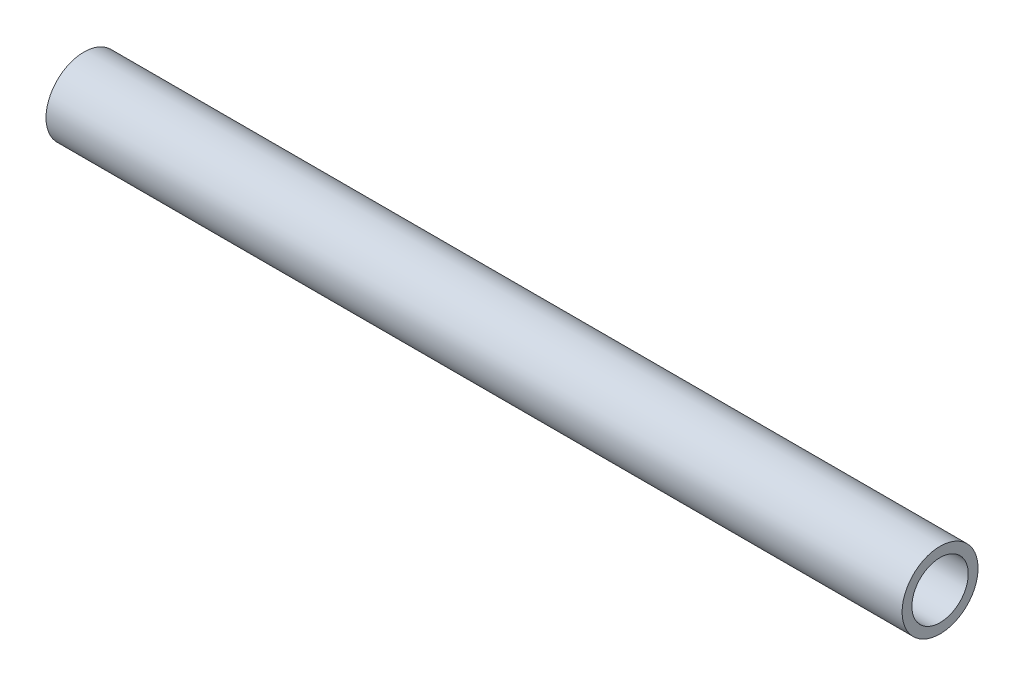
from build123d import *

# Parameters (mm, degrees)
CROQUIS1_R              = 10.65
CROQUIS1_R_2            = 7.9
SALIENTE_EXTRUIR1_DEPTH = 240


with BuildPart() as part:
    # Croquis1 → Saliente-Extruir1 (new body)
    with BuildSketch(Plane(origin=(0, 0, 0), x_dir=(0, 0, -1), z_dir=(1, 0, 0))):
        Circle(CROQUIS1_R)
        Circle(CROQUIS1_R_2, mode=Mode.SUBTRACT)
    extrude(amount=SALIENTE_EXTRUIR1_DEPTH)


solid = part.part
